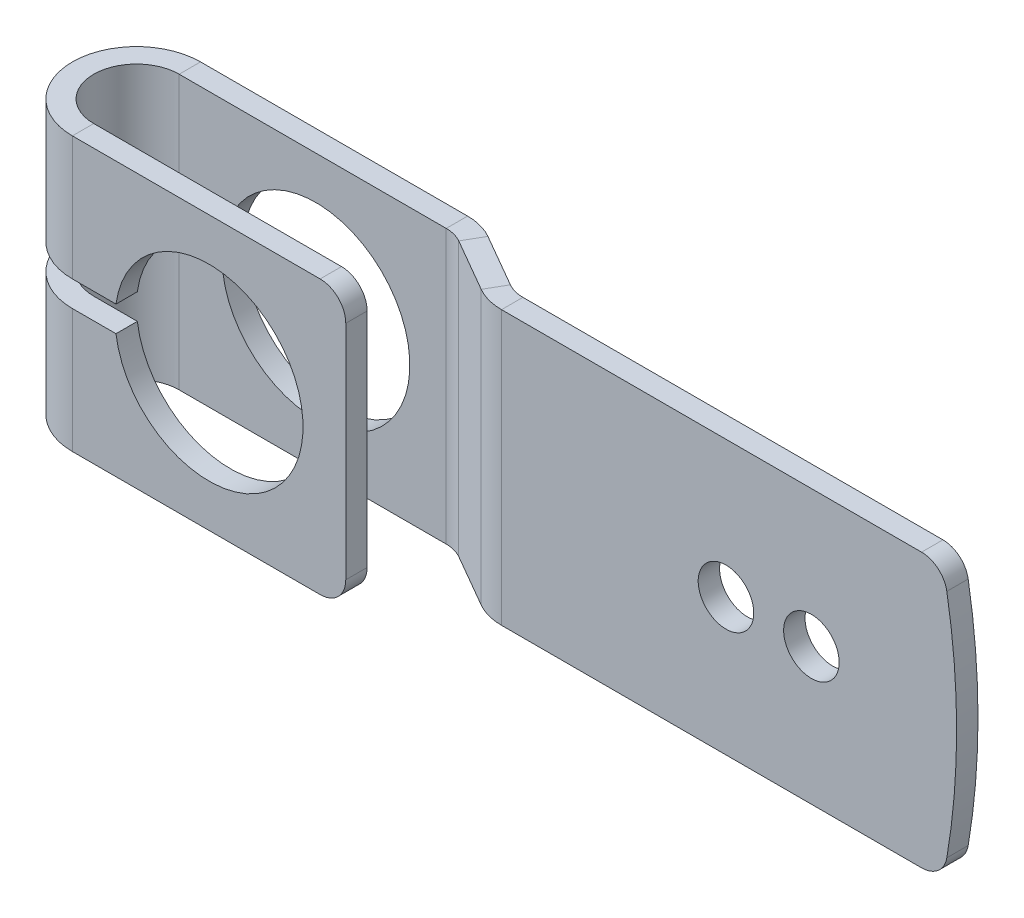
from build123d import *

# Parameters (mm, degrees)
BASE_FLANGE1_DEPTH      = 16
CUT_EXTRUDE1_START      = -15
CUT_EXTRUDE1_DEPTH      = 15
SKETCH7_R               = 3.25
CUT_EXTRUDE2_DEPTH      = 10
CUT_EXTRUDE3_DEPTH      = 98.612755314
CUT_EXTRUDE3_DEPTH_BACK = 2.5
FILLET1_R               = 3


# Read off the part's stored shape, not the designer's step: Cut-Extrude1
# Sheet-metal steps are written as plain solids
with BuildPart() as part:
    # Sketch1 → Base-Flange1 (new, symmetric)
    with BuildSketch(Plane(origin=(0, 0, 0), x_dir=(1, 0, 0), z_dir=(0, 1, 0))):
        with BuildLine():
            Line((32, -7.5), (0, -7.5))
            ThreePointArc((0, -7.5), (-7.5, 0), (0, 7.5))
            Line((0, 7.5), (31.258330249, 7.5))
            ThreePointArc((31.258330249, 7.5), (32.940654042, 7.278517871), (34.508330249, 6.629165125))
            Line((34.508330249, 6.629165125), (40.732050808, 3.035898385))
            ThreePointArc((40.732050808, 3.035898385), (41.696774627, 2.636296695), (42.732050808, 2.5))
            Line((42.732050808, 2.5), (96, 2.5))
            Line((96, 2.5), (96, 0))
            Line((96, 0), (42.732050808, 0))
            ThreePointArc((42.732050808, 0), (41.049727014, 0.221482129), (39.482050808, 0.870834875))
            Line((39.482050808, 0.870834875), (33.258330249, 4.464101615))
            ThreePointArc((33.258330249, 4.464101615), (32.29360643, 4.863703305), (31.258330249, 5))
            Line((31.258330249, 5), (0, 5))
            ThreePointArc((0, 5), (-5, 0), (0, -5))
            Line((0, -5), (32, -5))
            Line((32, -5), (32, -7.5))
        make_face()
    extrude(amount=BASE_FLANGE1_DEPTH, both=True)

    # Cut-Extrude1 outline → Cut-Extrude1 (cut)
    with BuildSketch(Plane.XY.offset(7.5).offset(CUT_EXTRUDE1_START)):
        with BuildLine():
            Line((5.102752641, 1.5), (-7.5, 1.5))
            Line((-7.5, 1.5), (-7.5, -1.5))
            Line((-7.5, -1.5), (5.102752641, -1.5))
            ThreePointArc((5.102752641, -1.5), (27, 0), (5.102752641, 1.5))
        make_face()
    extrude(amount=CUT_EXTRUDE1_DEPTH, mode=Mode.SUBTRACT)

    # Sketch7 → Cut-Extrude2 (cut)
    with BuildSketch(Plane.XY):
        with Locations((79, 0)):
            Circle(SKETCH7_R)
        with Locations((69, 0)):
            Circle(SKETCH7_R)
    extrude(amount=-CUT_EXTRUDE2_DEPTH, mode=Mode.SUBTRACT)

    # Sketch8 → Cut-Extrude3 (cut, two sides: drawn at the far end of the back side and taken through both)
    with BuildSketch(Plane.XY.offset(-CUT_EXTRUDE3_DEPTH_BACK)):
        with BuildLine():
            Line((49.66733752, 235.064404157), (94.383671769, 16))
            ThreePointArc((94.383671769, 16), (96, 0), (94.383671769, -16))
            Line((94.383671769, -16), (49.66733752, -235.064404157))
            Line((49.66733752, -235.064404157), (496.830680013, -235.064404157))
            Line((496.830680013, -235.064404157), (496.830680013, 235.064404157))
            Line((496.830680013, 235.064404157), (49.66733752, 235.064404157))
        make_face()
    extrude(amount=CUT_EXTRUDE3_DEPTH + CUT_EXTRUDE3_DEPTH_BACK, mode=Mode.SUBTRACT)

    # Fillet1
    fillet1_edges = [part.edges().sort_by_distance(p)[0] for p in [
        (94.383671769, 16, -1.25),
        (94.383671769, -16, -1.25),
        (32, -16, 6.25),
        (32, 16, 6.25),
    ]]
    fillet(fillet1_edges, radius=FILLET1_R)


solid = part.part
